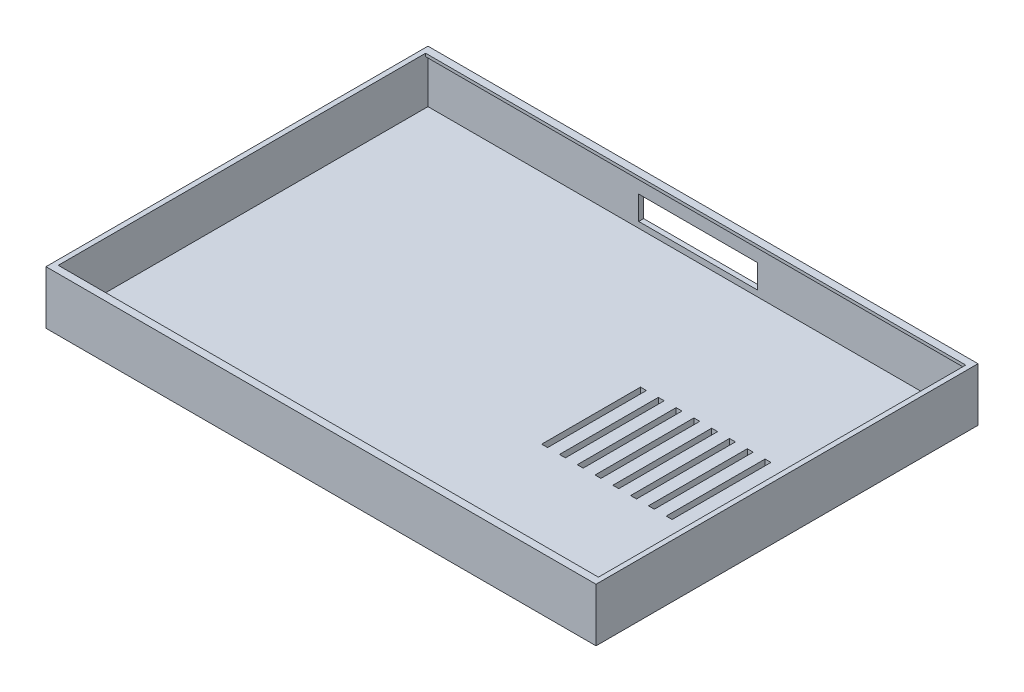
from build123d import *

# Parameters (mm, degrees)
SKETCH1_W            = 278.2
SKETCH1_H            = 193.2
SHELL_BLOCK_DEPTH    = 27
SKETCH2_W            = 273.2
SKETCH2_H            = 185.8
FRONT_OPENING_DEPTH  = 1.5
SKETCH3_W            = 273.2
SKETCH3_H            = 188.2
DISPLAY_POCKET_DEPTH = 22.5
SKETCH4_W            = 3
SKETCH4_H            = 50
VENT_SLOTS_DEPTH     = 4
SKETCH5_W            = 60
SKETCH5_H            = 12
CABLE_EXIT_DEPTH     = 97.6
DOVETAIL_RAIL_DEPTH  = 45


with BuildPart() as part:
    # Sketch1 → Shell Block (new body)
    with BuildSketch(Plane(origin=(0, 0, 0), x_dir=(1, 0, 0), z_dir=(0, 1, 0))):
        Rectangle(SKETCH1_W, SKETCH1_H)
    extrude(amount=SHELL_BLOCK_DEPTH)

    # Sketch2 → Front Opening (cut)
    with BuildSketch(Plane(origin=(0, 27, 0), x_dir=(1, 0, 0), z_dir=(0, 1, 0))):
        Rectangle(SKETCH2_W, SKETCH2_H)
    extrude(amount=-FRONT_OPENING_DEPTH, mode=Mode.SUBTRACT)

    # Sketch3 → Display Pocket (cut)
    with BuildSketch(Plane(origin=(0, 25.5, 0), x_dir=(1, 0, 0), z_dir=(0, 1, 0))):
        Rectangle(SKETCH3_W, SKETCH3_H)
    extrude(amount=-DISPLAY_POCKET_DEPTH, mode=Mode.SUBTRACT)

    # Sketch4 → Vent Slots (cut)
    with BuildSketch(Plane(origin=(0, 3, 0), x_dir=(1, 0, 0), z_dir=(0, 1, 0))):
        with Locations((41.5, 0)):
            Rectangle(SKETCH4_W, SKETCH4_H)
        with Locations((50.5, 0)):
            Rectangle(SKETCH4_W, SKETCH4_H)
        with Locations((59.5, 0)):
            Rectangle(SKETCH4_W, SKETCH4_H)
        with Locations((68.5, 0)):
            Rectangle(SKETCH4_W, SKETCH4_H)
        with Locations((77.5, 0)):
            Rectangle(SKETCH4_W, SKETCH4_H)
        with Locations((86.5, 0)):
            Rectangle(SKETCH4_W, SKETCH4_H)
        with Locations((95.5, 0)):
            Rectangle(SKETCH4_W, SKETCH4_H)
        with Locations((104.5, 0)):
            Rectangle(SKETCH4_W, SKETCH4_H)
    extrude(amount=-VENT_SLOTS_DEPTH, mode=Mode.SUBTRACT)

    # Sketch5 → Cable Exit (cut)
    with BuildSketch(Plane.XY):
        with Locations((0, 12)):
            Rectangle(SKETCH5_W, SKETCH5_H)
    extrude(amount=-CABLE_EXIT_DEPTH, mode=Mode.SUBTRACT)

    # Sketch7 → Dovetail Rail (add, symmetric)
    with BuildSketch(Plane.XY):
        Polygon((-15, 0.5), (15, 0.5), (19, -6), (-19, -6), align=None)
    extrude(amount=DOVETAIL_RAIL_DEPTH, both=True)


solid = part.part
